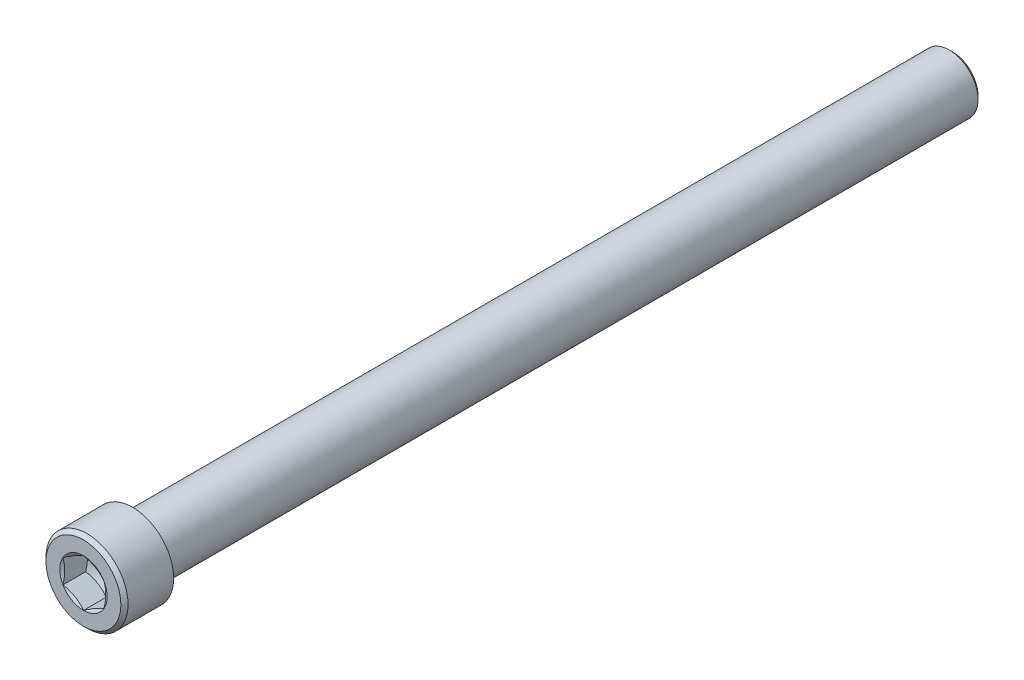
from build123d import *

# Parameters (mm, degrees)
CHAMFER1_SIZE      = 0.875
CUT_EXTRUDE1_REACH = 214.471
FILLET2_R          = 0.6


with BuildPart() as part:
    # Sketch1 → Revolve1 (revolve)
    with BuildSketch(Plane(origin=(0, 0, 0), x_dir=(0, 0, -1), z_dir=(1, 0, 0))):
        Polygon((0, 10), (-12, 10), (-12, 0), (200, 0), (200, 7), (0, 7), align=None)
    revolve(axis=Axis((0, 0, 12), (0, 0, -1)))

    # Sketch7 → Cut-Revolve2 (revolve, cut)
    with BuildSketch(Plane(origin=(0, 0, 0), x_dir=(0, 0, -1), z_dir=(1, 0, 0))):
        Polygon((-12, 0), (-12, 5), (-6, 5), (-3.113248654, 0), align=None)
    revolve(axis=Axis((0, 0, 12), (0, 0, -1)), mode=Mode.SUBTRACT)

    # Chamfer1
    chamfer1_edges = [part.edges().sort_by_distance(p)[0] for p in [
        (0, -7, -200),
        (0, -10, 12),
    ]]
    chamfer(chamfer1_edges, length=CHAMFER1_SIZE)

    # Cut-Extrude1: up to this cone (the profile starts inside it)
    cut_extrude1_end = Plane(origin=(0, 0, 12), z_dir=(0, 0, 1)).offset(-8.886750346) * Cone(1.732e-06, 414.393253037, 239.250055191, align=(Align.CENTER, Align.CENTER, Align.MIN), mode=Mode.PRIVATE)
    # Sketch8 → Cut-Extrude1 (cut, up to the surface)
    with BuildSketch(Plane.XY.offset(12), mode=Mode.PRIVATE) as cut_extrude1_sk1:
        Polygon((0, 5.773502692), (-5, 2.886751346), (-5, -2.886751346), (0, -5.773502692), (5, -2.886751346), (5, 2.886751346), align=None)
    cut_extrude1_tool1 = extrude(cut_extrude1_sk1.sketch, amount=-CUT_EXTRUDE1_REACH, mode=Mode.PRIVATE) & cut_extrude1_end
    add(cut_extrude1_tool1.solids().sort_by_distance((0, 0, 12))[0], mode=Mode.SUBTRACT)

    # Sketch9 → Cut-Revolve3 (revolve, cut)
    with BuildSketch(Plane(origin=(0, 0, 0), x_dir=(0, 0, -1), z_dir=(1, 0, 0))):
        Polygon((-12.5, 6.639528096), (-12.5, 5), (-11.553418013, 5), align=None)
    revolve(axis=Axis((0, 0, 12), (0, 0, -1)), mode=Mode.SUBTRACT)

    # Fillet2
    fillet2_edges = [part.edges().sort_by_distance(p)[0] for p in [
        (0, -7, 0),
    ]]
    fillet(fillet2_edges, radius=FILLET2_R)


solid = part.part
